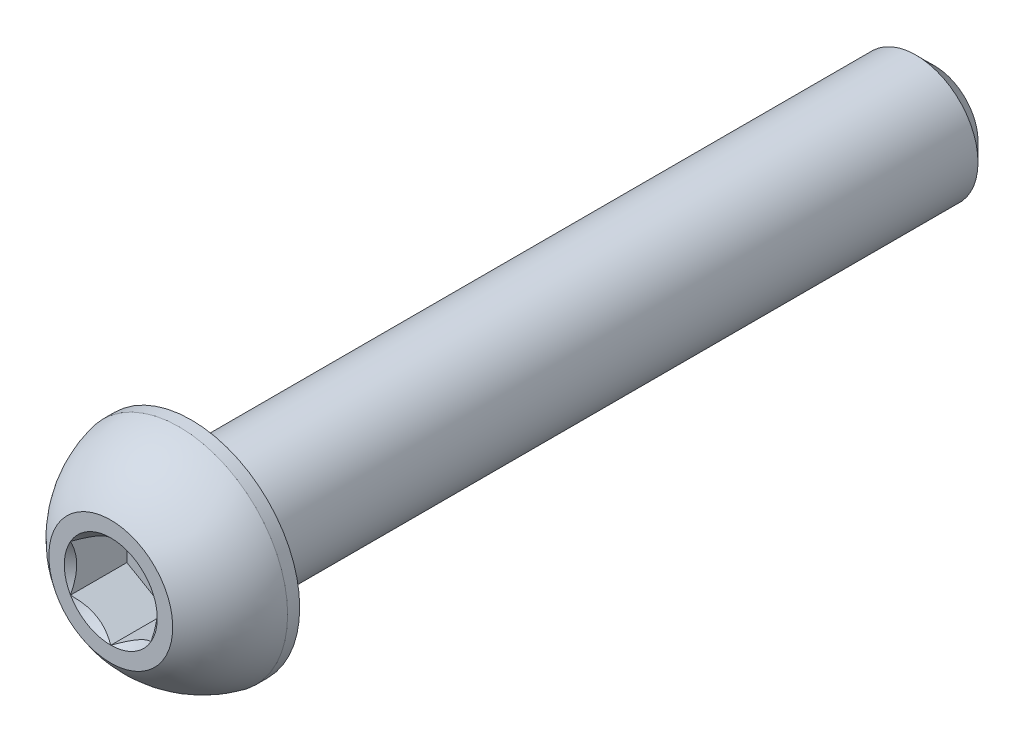
from build123d import *

# Parameters (mm, degrees)
CUT_EXTRUDE2_DEPTH = 0.91


with BuildPart() as part:
    # Sketch10 → Revolve3 (revolve)
    with BuildSketch(Plane(origin=(0, 0, 0), x_dir=(0, 0, -1), z_dir=(1, 0, 0)), mode=Mode.PRIVATE) as revolve3_sk:
        Polygon((13, 1), (13.3, 0.7), (13.3, 0), (1.3, 0), (1.3, 1), align=None)
    revolve(revolve3_sk.sketch.rotate(Axis((0, 0, 0), (0, 0, -1)), 90), axis=Axis((0, 0, 0), (0, 0, -1)))

    # Sketch7 → Revolve2 (revolve)
    with BuildSketch(Plane(origin=(0, 0, 0), x_dir=(0, 0, -1), z_dir=(1, 0, 0)), mode=Mode.PRIVATE) as revolve2_sk:
        with BuildLine():
            Line((1.105, 1.75), (1.3, 1.75))
            Line((1.3, 1.75), (1.3, 0))
            Line((1.3, 0), (0, 0))
            Line((0, 0), (0, 1))
            ThreePointArc((0, 1), (0.479976957, 1.481850617), (1.105, 1.75))
        make_face()
    revolve(revolve2_sk.sketch.rotate(Axis((0, 0, 0), (0, 0, -1)), 180), axis=Axis((0, 0, 0), (0, 0, -1)))

    # Sketch5 → Cut-Extrude2 (cut)
    with BuildSketch(Plane.XY):
        Polygon((0.65, -0.375277675), (0.65, 0.375277675), (0, 0.75055535), (-0.65, 0.375277675), (-0.65, -0.375277675), (0, -0.75055535), align=None)
    extrude(amount=-CUT_EXTRUDE2_DEPTH, mode=Mode.SUBTRACT)

    # Cut-Extrude3 cone 1 section (through the dimple's axis) → Cut-Extrude3 (revolve, cut)
    with BuildSketch(Plane(origin=(0, 0, 0), x_dir=(0, -1, 0), z_dir=(1, 0, 0))):
        Polygon((0, 0), (0.75055535, 0), (0, 0.75055535), align=None)
    revolve(axis=Axis((0, 0, 0), (0, 0, -1)), mode=Mode.SUBTRACT)


with BuildPart() as body_2:
    # Split1: read off the stored shape, not the designer's step
    # Split1: the piece on the far side of the plane
    add(part.part)
    split(bisect_by=Plane.XY.offset(-1.3), keep=Keep.BOTTOM)


with BuildPart() as part_1:
    add(part.part)

    # Split1
    split(bisect_by=Plane.XY.offset(-1.3), keep=Keep.TOP)


with BuildPart() as body_2_1:
    add(body_2.part)

    # Boss-Extrude1: read off the stored shape, not the designer's step
    # Boss-Extrude1: union part
    add(part_1.part)


solid = body_2_1.part
